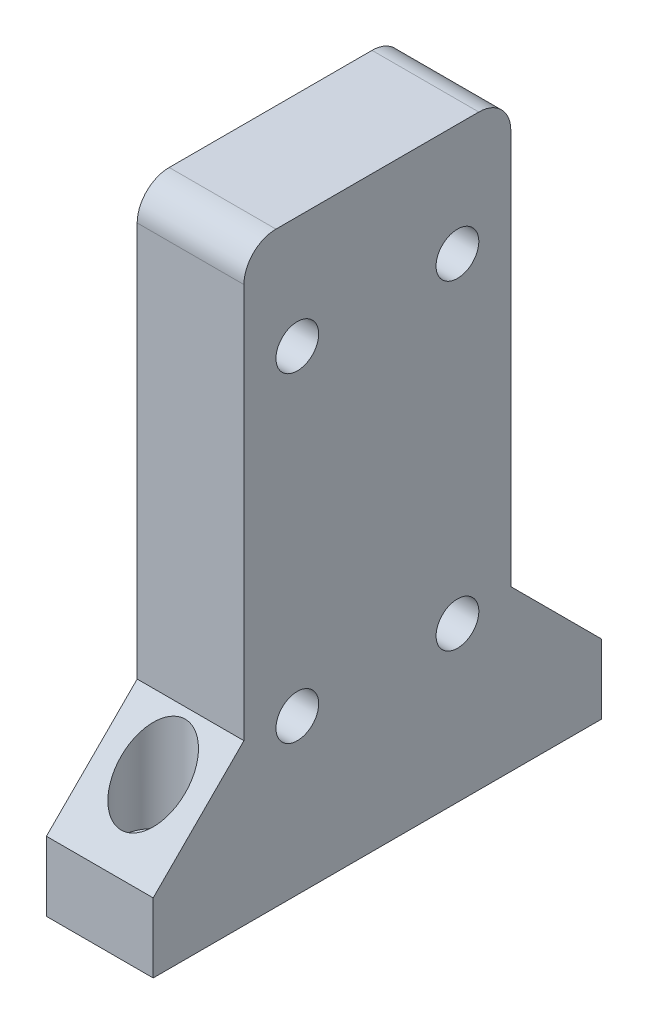
from build123d import *

# Parameters (mm, degrees)
SKETCH1_W           = 10
SKETCH1_H           = 42
BOSS_EXTRUDE1_DEPTH = 3
SKETCH7_W           = 10
SKETCH7_H           = 25
BOSS_EXTRUDE4_DEPTH = 52
CHAMFER2_SIZE       = 12
SKETCH8_R           = 1.75
CUT_EXTRUDE1_DEPTH  = 60.084684987
SKETCH9_R           = 3
CUT_EXTRUDE2_DEPTH  = 50
FILLET1_R           = 3
SKETCH10_R          = 2
CUT_EXTRUDE3_DEPTH  = 60.715994507


with BuildPart() as part:
    # Sketch1 → Boss-Extrude1 (new body)
    with BuildSketch(Plane(origin=(0, 0, 0), x_dir=(1, 0, 0), z_dir=(0, 1, 0))):
        Rectangle(SKETCH1_W, SKETCH1_H)
    extrude(amount=BOSS_EXTRUDE1_DEPTH)

    # Sketch7 → Boss-Extrude4 (add)
    with BuildSketch(Plane(origin=(0, 3, 0), x_dir=(1, 0, 0), z_dir=(0, 1, 0))):
        Rectangle(SKETCH7_W, SKETCH7_H)
    extrude(amount=BOSS_EXTRUDE4_DEPTH)

    # Chamfer2
    # the kernel refuses this chamfer: 12 mm, written as the material it adds along each edge
    with BuildSketch(Plane(origin=(5, 3, 12.5), x_dir=(0, -0.02749587661058638, 0.9996219169112968), z_dir=(-1, 0, 0))) as chamfer2_piece_1_section:
        Polygon((CHAMFER2_SIZE * 0.999621916911, CHAMFER2_SIZE * 0.0274958766106), (-CHAMFER2_SIZE * 0.0274958766106, CHAMFER2_SIZE * 0.999621916911), (0, 0), align=None)
    chamfer2_piece_1 = extrude(amount=10, mode=Mode.PRIVATE)
    chamfer2_piece_1 = split(chamfer2_piece_1, bisect_by=Plane(origin=(0, 7.292994705, 21), z_dir=(0, 0, -1)), keep=Keep.TOP, mode=Mode.PRIVATE)
    add(chamfer2_piece_1)
    with BuildSketch(Plane(origin=(-5, 3, -12.5), x_dir=(0, -0.02749587661058638, -0.9996219169112968), z_dir=(1, 0, 0))) as chamfer2_piece_2_section:
        Polygon((CHAMFER2_SIZE * 0.999621916911, CHAMFER2_SIZE * 0.0274958766106), (-CHAMFER2_SIZE * 0.0274958766106, CHAMFER2_SIZE * 0.999621916911), (0, 0), align=None)
    chamfer2_piece_2 = extrude(amount=10, mode=Mode.PRIVATE)
    chamfer2_piece_2 = split(chamfer2_piece_2, bisect_by=Plane(origin=(0, 7.292994705, -21), z_dir=(0, 0, 1)), keep=Keep.TOP, mode=Mode.PRIVATE)
    add(chamfer2_piece_2)

    # Sketch8 → Cut-Extrude1 (cut, through all)
    with BuildSketch(Plane(origin=(0, 55, 0), x_dir=(1, 0, 0), z_dir=(0, 1, 0))):
        with Locations(Location((0, 16, 0), (0, 0, 270))):
            Circle(SKETCH8_R)
        with Locations(Location((0, -16, 0), (0, 0, 270))):
            Circle(SKETCH8_R)
    extrude(amount=-CUT_EXTRUDE1_DEPTH, mode=Mode.SUBTRACT)

    # Sketch9 → Cut-Extrude2 (cut)
    with BuildSketch(Plane(origin=(0, 55, 0), x_dir=(1, 0, 0), z_dir=(0, 1, 0))):
        with Locations(Location((0, 16, 0), (0, 0, 270))):
            Circle(SKETCH9_R)
        with Locations(Location((0, -16, 0), (0, 0, 270))):
            Circle(SKETCH9_R)
    extrude(amount=-CUT_EXTRUDE2_DEPTH, mode=Mode.SUBTRACT)

    # Fillet1
    fillet1_edges = [part.edges().sort_by_distance(p)[0] for p in [
        (0, 55, -12.5),
        (0, 55, 12.5),
    ]]
    fillet(fillet1_edges, radius=FILLET1_R)

    # Sketch10 → Cut-Extrude3 (cut, through all)
    with BuildSketch(Plane.ZY.offset(5)):
        with Locations((-7.5, 14.5)):
            Circle(SKETCH10_R)
        with Locations((7.5, 14.5)):
            Circle(SKETCH10_R)
        with Locations((-7.5, 44.5)):
            Circle(SKETCH10_R)
        with Locations((7.5, 44.5)):
            Circle(SKETCH10_R)
    extrude(amount=-CUT_EXTRUDE3_DEPTH, mode=Mode.SUBTRACT)


solid = part.part
